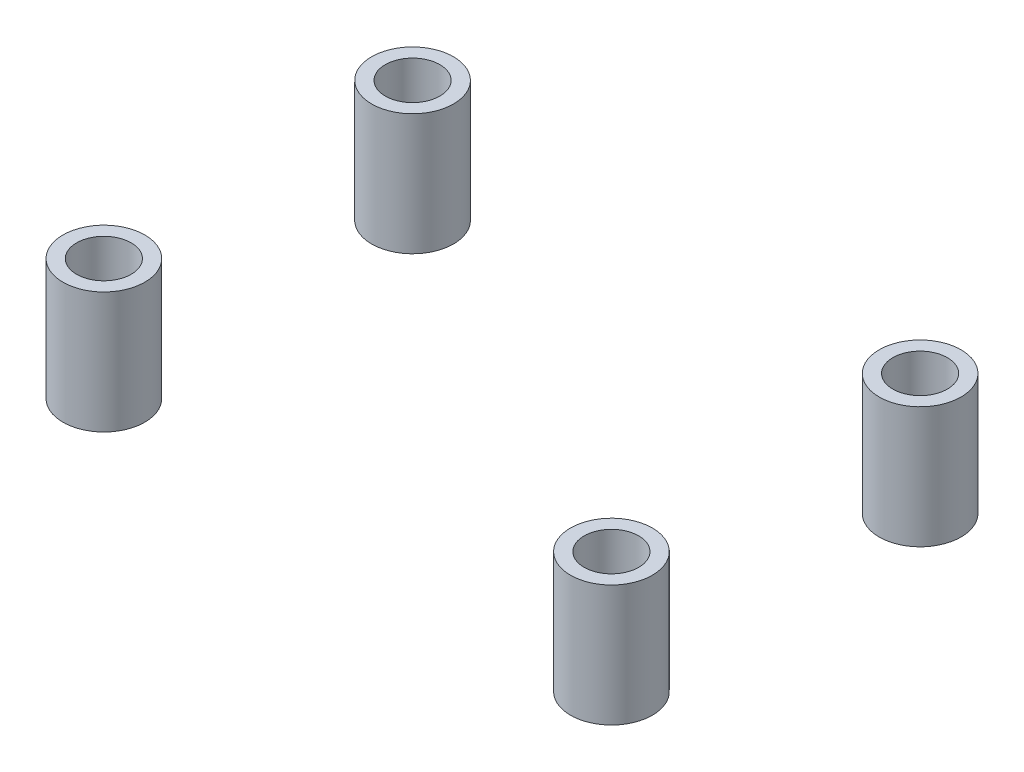
from build123d import *

# Parameters (mm, degrees)
BOSS_EXTRUDE2_DEPTH = 8.89
MIRROR4_OUTLINE_R   = 3
MIRROR4_OUTLINE_R_2 = 2
MIRROR4_DEPTH       = 8.89


# Read off the part's stored shape, not the designer's step: Mirror4
with BuildPart() as part:
    # Sketch1 → Boss-Extrude2 (new body)
    with BuildSketch(Plane(origin=(0, 0, 0), x_dir=(1, 0, 0), z_dir=(0, 1, 0))):
        with BuildLine():
            ThreePointArc((-18.599507831, 9.312387225), (-20.013721393, 12.726600788), (-16.599507831, 11.312387225))
            Line((-16.599507831, 11.312387225), (-15.599507831, 11.312387225))
            ThreePointArc((-15.599507831, 11.312387225), (-20.720828174, 13.433707569), (-18.599507831, 8.312387225))
            Line((-18.599507831, 8.312387225), (-18.599507831, 9.312387225))
        make_face()
        with BuildLine():
            Line((-15.599507831, 11.312387225), (-16.599507831, 11.312387225))
            ThreePointArc((-16.599507831, 11.312387225), (-17.185294268, 9.898173663), (-18.599507831, 9.312387225))
            Line((-18.599507831, 9.312387225), (-18.599507831, 8.312387225))
            ThreePointArc((-18.599507831, 8.312387225), (-16.478187487, 9.191066882), (-15.599507831, 11.312387225))
        make_face()
    extrude(amount=BOSS_EXTRUDE2_DEPTH)


with BuildPart() as body_2:
    # Mirror4 outline → Mirror4 (new body)
    # profile 1 of 3: a face of its own
    with BuildSketch(Plane(origin=(0, 0, 0), x_dir=(1, 0, 0), z_dir=(0, 1, 0))):
        with Locations((18.599507831, -11.312387225)):
            Circle(MIRROR4_OUTLINE_R)
        with Locations((18.599507831, -11.312387225)):
            Circle(MIRROR4_OUTLINE_R_2, mode=Mode.SUBTRACT)
    # profile 2 of 3: a face of its own
    with BuildSketch(Plane(origin=(0, 0, 0), x_dir=(1, 0, 0), z_dir=(0, 1, 0))):
        with Locations((18.599507831, 11.312387225)):
            Circle(MIRROR4_OUTLINE_R)
        with Locations((18.599507831, 11.312387225)):
            Circle(MIRROR4_OUTLINE_R_2, mode=Mode.SUBTRACT)
    # profile 3 of 3: a face of its own
    with BuildSketch(Plane(origin=(0, 0, 0), x_dir=(1, 0, 0), z_dir=(0, 1, 0))):
        with Locations((-18.599507831, -11.312387225)):
            Circle(MIRROR4_OUTLINE_R)
        with Locations((-18.599507831, -11.312387225)):
            Circle(MIRROR4_OUTLINE_R_2, mode=Mode.SUBTRACT)
    extrude(amount=MIRROR4_DEPTH)


solid = Compound([part.part, body_2.part])
